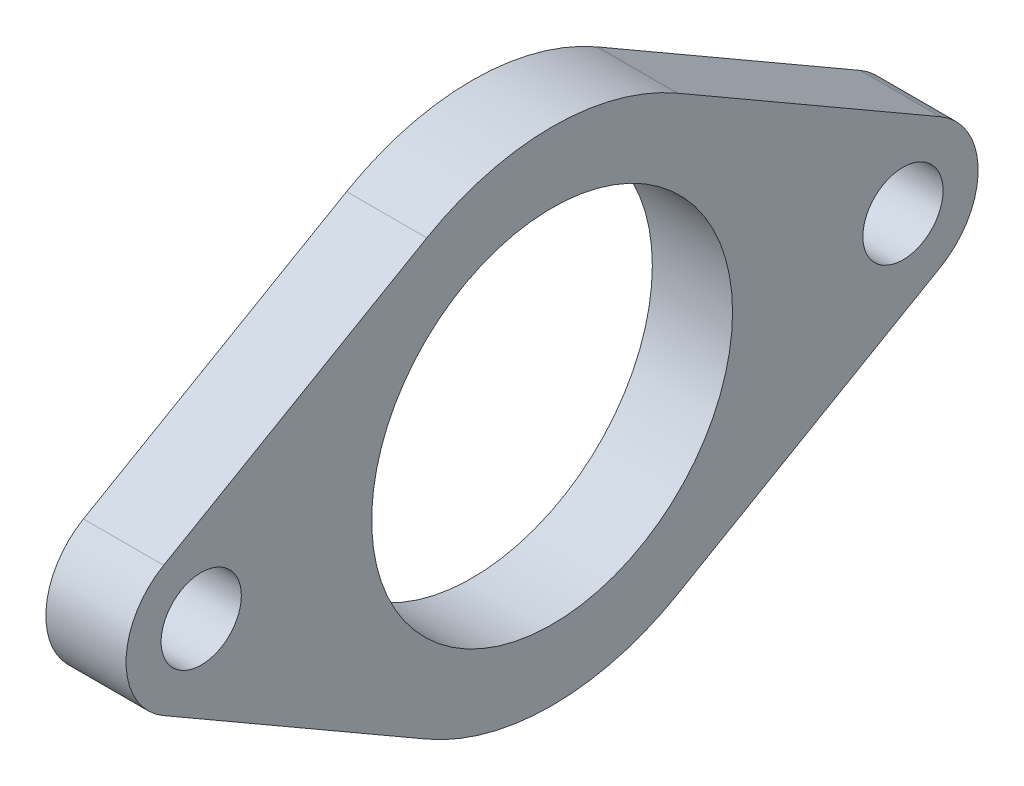
from build123d import *

# Parameters (mm, degrees)
BOSS_EXTRUDE1_DEPTH      = 4
BOSS_EXTRUDE1_DEPTH_BACK = 4
SKETCH1_R                = 4
CUT_EXTRUDE1_DEPTH       = 50.469687689
CUT_EXTRUDE1_DEPTH_BACK  = 50.469687689
SKETCH1_3_R              = 18


with BuildPart() as part:
    # Sketch1 → Boss-Extrude1 (new, two sides: drawn at the far end of the back side and taken through both)
    with BuildSketch(Plane(origin=(0, 0, 0), x_dir=(0, 0, -1), z_dir=(1, 0, 0)).offset(-BOSS_EXTRUDE1_DEPTH_BACK)):
        with BuildLine():
            ThreePointArc((-38.75, 6.495190528), (-42.5, 0), (-38.75, -6.495190528))
            Line((-38.75, -6.495190528), (-12.5, -21.650635095))
            ThreePointArc((-12.5, -21.650635095), (0, -25), (12.5, -21.650635095))
            Line((12.5, -21.650635095), (38.75, -6.495190528))
            ThreePointArc((38.75, -6.495190528), (42.5, 0), (38.75, 6.495190528))
            Line((38.75, 6.495190528), (12.5, 21.650635095))
            ThreePointArc((12.5, 21.650635095), (0, 25), (-12.5, 21.650635095))
            Line((-12.5, 21.650635095), (-38.75, 6.495190528))
        make_face()
        with Locations((-35, 0)):
            Circle(SKETCH1_R, mode=Mode.SUBTRACT)
        with Locations((35, 0)):
            Circle(SKETCH1_R, mode=Mode.SUBTRACT)
    extrude(amount=BOSS_EXTRUDE1_DEPTH + BOSS_EXTRUDE1_DEPTH_BACK)

    # Sketch1<3> → Cut-Extrude1 (cut, two sides: drawn at the far end of the back side and taken through both)
    with BuildSketch(Plane(origin=(0, 0, 0), x_dir=(0, 0, -1), z_dir=(1, 0, 0)).offset(-CUT_EXTRUDE1_DEPTH_BACK)):
        Circle(SKETCH1_3_R)
    extrude(amount=CUT_EXTRUDE1_DEPTH + CUT_EXTRUDE1_DEPTH_BACK, mode=Mode.SUBTRACT)


solid = part.part
